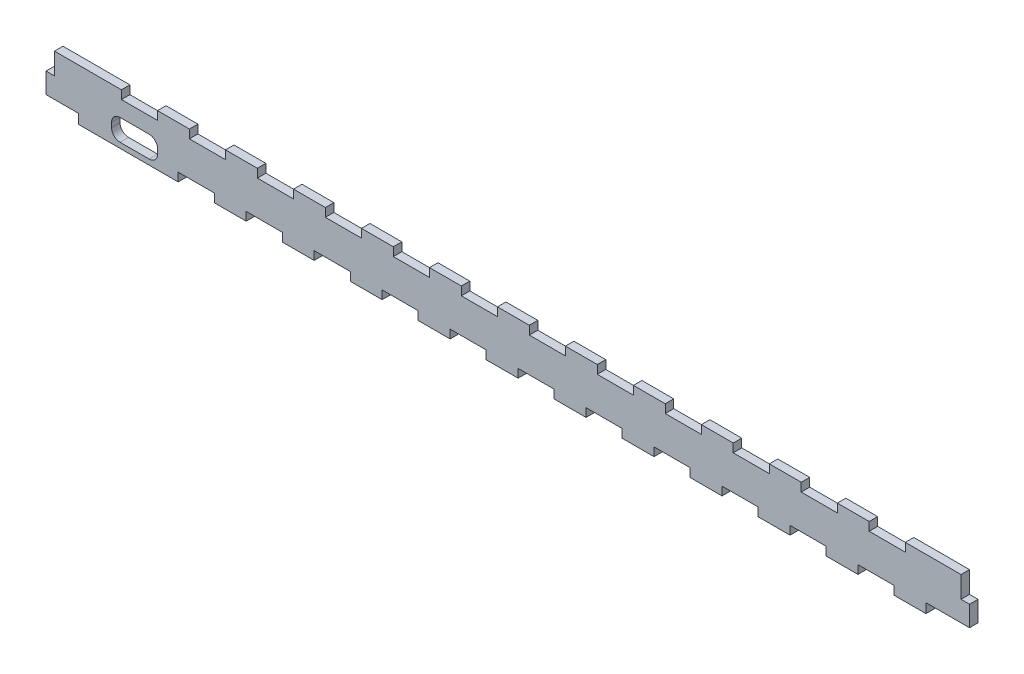
from build123d import *

# Parameters (mm, degrees)
ESQUISSE1_W             = 217.36
ESQUISSE1_H             = 12.11
BOSS_EXTRU_1_DEPTH      = 2
ESQUISSE2_W             = 8.5
ESQUISSE2_H             = 2
ESQUISSE2_W_2           = 10.25
ESQUISSE2_H_2           = 2.25
ENL_V_MAT_EXTRU_1_DEPTH = 109.866916118
ENL_V_MAT_EXTRU_2_DEPTH = 109.866916118
ESQUISSE5_W             = 2
ESQUISSE5_H             = 5.055
ENL_V_MAT_EXTRU_3_DEPTH = 109.866916118


with BuildPart() as part:
    # Esquisse1 → Boss.-Extru.1 (new body)
    with BuildSketch(Plane.XY):
        Rectangle(ESQUISSE1_W, ESQUISSE1_H)
    extrude(amount=BOSS_EXTRU_1_DEPTH)

    # Esquisse2 → Enlèv. mat.-Extru.1 (cut, through all)
    with BuildSketch(Plane.XY.offset(2)):
        Polygon((-109.57, -4.055), (-108.68, -4.055), (-108.68, -3.805), (-101.07, -3.805), (-101.07, -4.055), (-101.07, -6.055), (-109.57, -6.055), align=None)
        with Locations((-86.68, 5.055)):
            Rectangle(ESQUISSE2_W, ESQUISSE2_H)
        with Locations((-73.32, -5.055)):
            Rectangle(ESQUISSE2_W, ESQUISSE2_H)
        with Locations((-57.32, -5.055)):
            Rectangle(ESQUISSE2_W, ESQUISSE2_H)
        with Locations((-41.32, -5.055)):
            Rectangle(ESQUISSE2_W, ESQUISSE2_H)
        with Locations((-25.32, -5.055)):
            Rectangle(ESQUISSE2_W, ESQUISSE2_H)
        with Locations((-9.32, -5.055)):
            Rectangle(ESQUISSE2_W, ESQUISSE2_H)
        with Locations((6.68, -5.055)):
            Rectangle(ESQUISSE2_W, ESQUISSE2_H)
        with Locations((22.68, -5.055)):
            Rectangle(ESQUISSE2_W, ESQUISSE2_H)
        with Locations((38.68, -5.055)):
            Rectangle(ESQUISSE2_W, ESQUISSE2_H)
        with Locations((54.68, -5.055)):
            Rectangle(ESQUISSE2_W, ESQUISSE2_H)
        with Locations((70.68, -5.055)):
            Rectangle(ESQUISSE2_W, ESQUISSE2_H)
        with Locations((86.68, -5.055)):
            Rectangle(ESQUISSE2_W, ESQUISSE2_H)
        with Locations((-70.68, 5.055)):
            Rectangle(ESQUISSE2_W, ESQUISSE2_H)
        with Locations((-54.68, 5.055)):
            Rectangle(ESQUISSE2_W, ESQUISSE2_H)
        with Locations((-38.68, 5.055)):
            Rectangle(ESQUISSE2_W, ESQUISSE2_H)
        with Locations((-22.68, 5.055)):
            Rectangle(ESQUISSE2_W, ESQUISSE2_H)
        with Locations((-6.68, 5.055)):
            Rectangle(ESQUISSE2_W, ESQUISSE2_H)
        with Locations((9.32, 5.055)):
            Rectangle(ESQUISSE2_W, ESQUISSE2_H)
        with Locations((25.32, 5.055)):
            Rectangle(ESQUISSE2_W, ESQUISSE2_H)
        with Locations((41.32, 5.055)):
            Rectangle(ESQUISSE2_W, ESQUISSE2_H)
        with Locations((57.32, 5.055)):
            Rectangle(ESQUISSE2_W, ESQUISSE2_H)
        with Locations((73.32, 5.055)):
            Rectangle(ESQUISSE2_W, ESQUISSE2_H)
        with Locations((89.32, 5.055)):
            Rectangle(ESQUISSE2_W, ESQUISSE2_H)
        with Locations((103.555, -4.93)):
            Rectangle(ESQUISSE2_W_2, ESQUISSE2_H_2)
    extrude(amount=-ENL_V_MAT_EXTRU_1_DEPTH, mode=Mode.SUBTRACT)

    # Esquisse3 → Enlèv. mat.-Extru.2 (cut, through all)
    with BuildSketch(Plane.XY.offset(2)):
        with BuildLine():
            Line((-91.252, 0.255), (-84.412, 0.255))
            ThreePointArc((-84.412, 0.255), (-82.997786438, -0.330786438), (-82.412, -1.745))
            Line((-82.412, -1.745), (-82.412, -2.805))
            ThreePointArc((-82.412, -2.805), (-82.997786438, -4.219213562), (-84.412, -4.805))
            Line((-84.412, -4.805), (-91.252, -4.805))
            ThreePointArc((-91.252, -4.805), (-92.666213562, -4.219213562), (-93.252, -2.805))
            Line((-93.252, -2.805), (-93.252, -1.745))
            ThreePointArc((-93.252, -1.745), (-92.666213562, -0.330786438), (-91.252, 0.255))
        make_face()
    extrude(amount=-ENL_V_MAT_EXTRU_2_DEPTH, mode=Mode.SUBTRACT)

    # Esquisse5 → Enlèv. mat.-Extru.3 (cut, through all)
    with BuildSketch(Plane.XY.offset(2)):
        with Locations((-107.68, 3.5275)):
            Rectangle(ESQUISSE5_W, ESQUISSE5_H)
        with Locations((107.68, 3.5275)):
            Rectangle(ESQUISSE5_W, ESQUISSE5_H)
    extrude(amount=-ENL_V_MAT_EXTRU_3_DEPTH, mode=Mode.SUBTRACT)


solid = part.part
